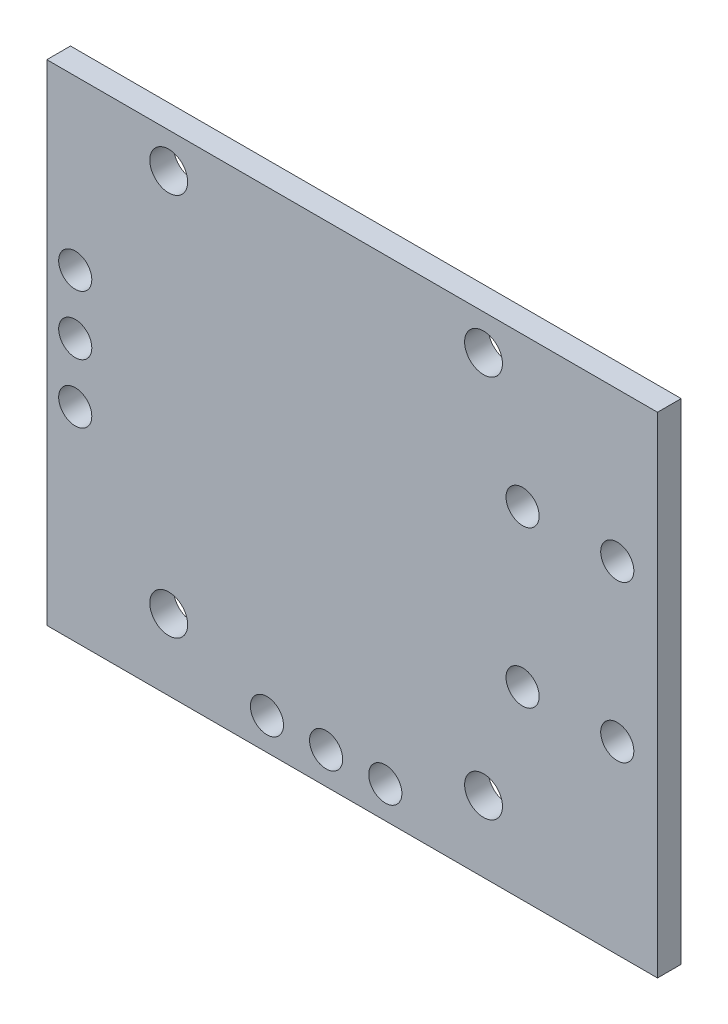
from build123d import *

# Parameters (mm, degrees)
SKETCH_1_W      = 25.8
SKETCH_1_H      = 20.7
SKETCH_1_R      = 0.8
SKETCH_1_R_2    = 0.7
EXTRUDE_1_DEPTH = 1


with BuildPart() as part:
    # ｽｹｯﾁ1 → ﾎﾞｽ - 押し出し1 (new body)
    with BuildSketch(Plane.XY):
        with Locations((12.9, -10.35)):
            Rectangle(SKETCH_1_W, SKETCH_1_H)
        with Locations((5.15, -17.7)):
            Circle(SKETCH_1_R, mode=Mode.SUBTRACT)
        with Locations((9.3, -19.35)):
            Circle(SKETCH_1_R_2, mode=Mode.SUBTRACT)
        with Locations((11.8, -19.35)):
            Circle(SKETCH_1_R_2, mode=Mode.SUBTRACT)
        with Locations((1.2, -12.1)):
            Circle(SKETCH_1_R_2, mode=Mode.SUBTRACT)
        with Locations((14.3, -19.35)):
            Circle(SKETCH_1_R_2, mode=Mode.SUBTRACT)
        with Locations((18.45, -17.7)):
            Circle(SKETCH_1_R, mode=Mode.SUBTRACT)
        with Locations((20.1, -12.9)):
            Circle(SKETCH_1_R_2, mode=Mode.SUBTRACT)
        with Locations((24.1, -12.9)):
            Circle(SKETCH_1_R_2, mode=Mode.SUBTRACT)
        with Locations((1.2, -9.6)):
            Circle(SKETCH_1_R_2, mode=Mode.SUBTRACT)
        with Locations((1.2, -7.1)):
            Circle(SKETCH_1_R_2, mode=Mode.SUBTRACT)
        with Locations((5.15, -1.5)):
            Circle(SKETCH_1_R, mode=Mode.SUBTRACT)
        with Locations((20.1, -6.3)):
            Circle(SKETCH_1_R_2, mode=Mode.SUBTRACT)
        with Locations((24.1, -6.3)):
            Circle(SKETCH_1_R_2, mode=Mode.SUBTRACT)
        with Locations((18.45, -1.5)):
            Circle(SKETCH_1_R, mode=Mode.SUBTRACT)
    extrude(amount=EXTRUDE_1_DEPTH)


solid = part.part
